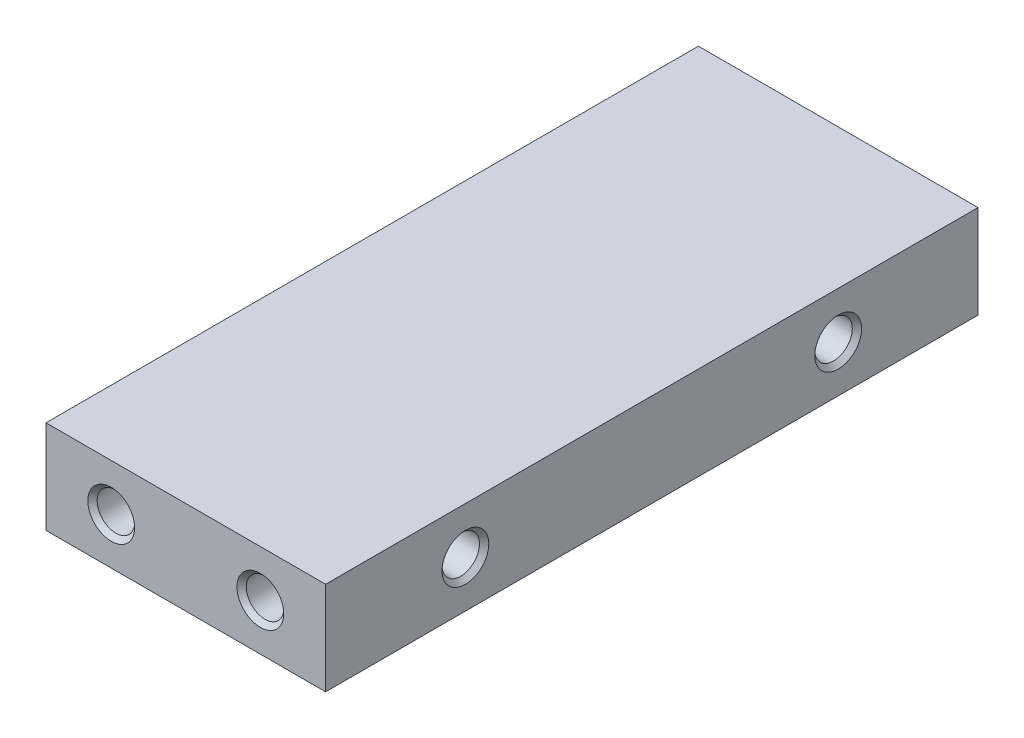
from build123d import *

# Parameters (mm, degrees)
SKETCH1_W                         = 38.1
SKETCH1_H                         = 12.7
BOSS_EXTRUDE1_DEPTH               = 88.9
F_1_4_20_TAPPED_HOLE1_AT_2_COUNT  = 2
F_1_4_20_TAPPED_HOLE1_AT_2_PITCH  = 20.32
F_1_4_20_TAPPED_HOLE2_D           = 5.1054
F_1_4_20_TAPPED_HOLE2_DEPTH       = 13.97
F_1_4_20_TAPPED_HOLE2_CSINK_D     = 6.3754
F_1_4_20_TAPPED_HOLE2_CSINK_ANGLE = 90
F_1_4_20_TAPPED_HOLE2_TIP         = 1.533816902


with BuildPart() as part:
    # Sketch1 → Boss-Extrude1 (new body)
    with BuildSketch(Plane.XY):
        Rectangle(SKETCH1_W, SKETCH1_H)
    extrude(amount=-BOSS_EXTRUDE1_DEPTH)

    # Sketch4 → 1/4-20 Tapped Hole1 (revolve, cut)
    with BuildSketch(Plane(origin=(-10.16, 0, 0), x_dir=(0, -1, 0), z_dir=(1, 0, 0))):
        Polygon((0, 0), (0, 15.503816902), (2.5527, 13.97), (2.5527, 0.635), (3.1877, 0), align=None)
    f_1_4_20_tapped_hole1 = revolve(axis=Axis((-10.16, 0, 6.35), (0, 0, -1)), mode=Mode.SUBTRACT)

    # 1/4-20 Tapped Hole1 at 2: 1/4-20 Tapped Hole1 ×2
    with Locations(*[(i * F_1_4_20_TAPPED_HOLE1_AT_2_PITCH, 0, 0) for i in range(1, F_1_4_20_TAPPED_HOLE1_AT_2_COUNT)]):
        add(f_1_4_20_tapped_hole1, mode=Mode.SUBTRACT)

    # Mirror1: 1/4-20 Tapped Hole1 across plane
    add(f_1_4_20_tapped_hole1.mirror(Plane.XY.offset(-44.45)), mode=Mode.SUBTRACT)

    # Mirror1 copy 1 sketch → Mirror1 copy 1 (revolve, cut)
    with BuildSketch(Plane(origin=(10.16, 0, -88.9), x_dir=(0, -1, 0), z_dir=(1, 0, 0))):
        Polygon((0, 0), (0, -15.503816902), (2.5527, -13.97), (2.5527, -0.635), (3.1877, 0), align=None)
    revolve(axis=Axis((10.16, 0, -95.25), (0, 0, -1)), mode=Mode.SUBTRACT)

    # 1/4-20 Tapped Hole2
    with Locations(Plane(origin=(19.05, 0, 0), x_dir=(0, 0, -1), z_dir=(1, 0, 0))):
        with Locations((19.05, 0), (69.85, 0)):
            CounterSinkHole(F_1_4_20_TAPPED_HOLE2_D / 2, F_1_4_20_TAPPED_HOLE2_CSINK_D / 2, depth=F_1_4_20_TAPPED_HOLE2_DEPTH, counter_sink_angle=F_1_4_20_TAPPED_HOLE2_CSINK_ANGLE)
            with Locations((0, 0, -(F_1_4_20_TAPPED_HOLE2_DEPTH + F_1_4_20_TAPPED_HOLE2_TIP / 2))):  # 118° drill point
                Cone(0, F_1_4_20_TAPPED_HOLE2_D / 2, F_1_4_20_TAPPED_HOLE2_TIP, mode=Mode.SUBTRACT)


solid = part.part
